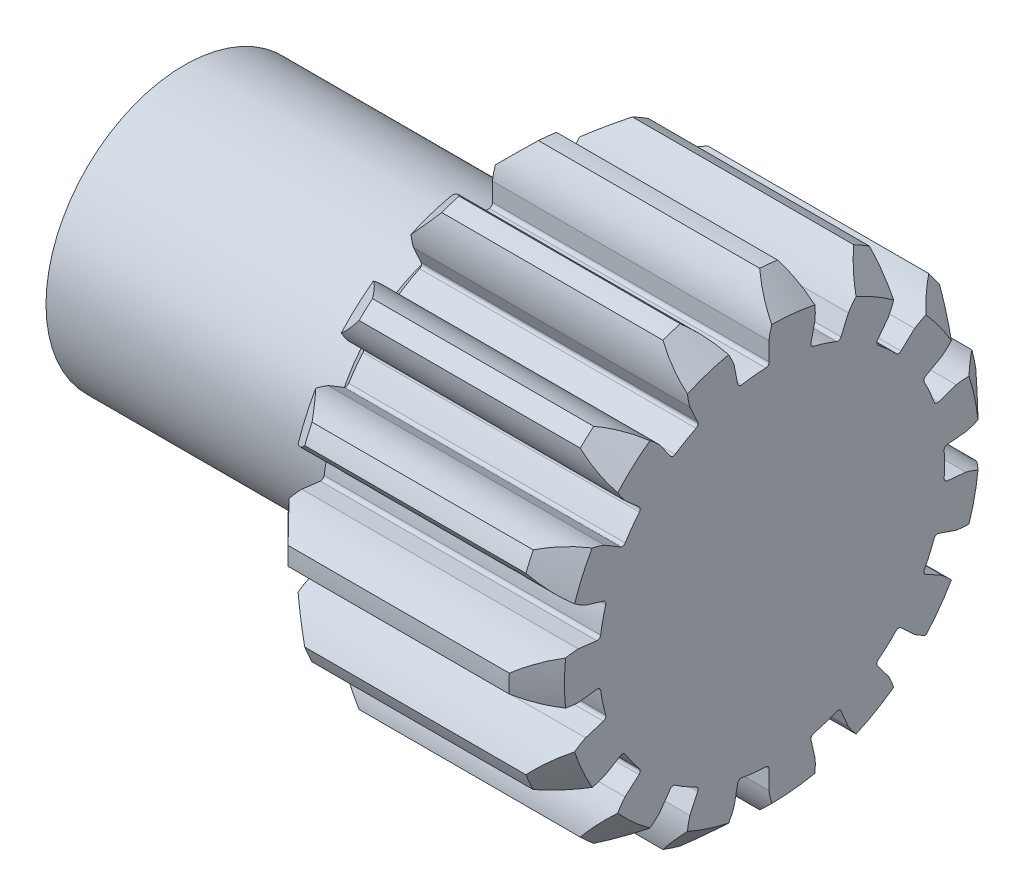
from build123d import *

# Parameters (mm, degrees)
SKETCH_2_R                       = 5
EXTRUDE_2_DEPTH                  = 8
SKETCH_5_R                       = 4
EXTRUDE_4_DEPTH                  = 9
HOLE_WIZARD_M31_D                = 2.5
HOLE_WIZARD_M31_DEPTH            = 8.5
HOLE_WIZARD_M31_CSINK_D          = 5
HOLE_WIZARD_M31_CSINK_ANGLE      = 90
HOLE_WIZARD_M31_TIP              = 0.751075774
EXTRUDE_5_REACH                  = 16.799
EXTRUDE_5_DIRECTION_2_REACH      = 16.799
FILLET_4_R                       = 0.1
PATTERN_CIRCULAR_1_COUNT         = 15
FILLET_4_OF_PATTERN_CIRCULAR_1_R = 0.1
FILLET_5_R                       = 0.2


with BuildPart() as part:
    # Эскиз2 → Бобышка-Вытянуть2 (new body)
    with BuildSketch(Plane(origin=(0, 0, 0), x_dir=(0, 0, -1), z_dir=(1, 0, 0))):
        Circle(SKETCH_2_R)
    extrude(amount=EXTRUDE_2_DEPTH)

    # Эскиз5 → Бобышка-Вытянуть4 (add)
    with BuildSketch(Plane.ZY):
        Circle(SKETCH_5_R)
    extrude(amount=EXTRUDE_4_DEPTH)

    # Отверстие обработанное метчиком M31
    with Locations(Plane.ZY.offset(9)):
        with Locations((0, 0)):
            CounterSinkHole(HOLE_WIZARD_M31_D / 2, HOLE_WIZARD_M31_CSINK_D / 2, depth=HOLE_WIZARD_M31_DEPTH, counter_sink_angle=HOLE_WIZARD_M31_CSINK_ANGLE)
            with Locations((0, 0, -(HOLE_WIZARD_M31_DEPTH + HOLE_WIZARD_M31_TIP / 2))):  # 118° drill point
                Cone(0, HOLE_WIZARD_M31_D / 2, HOLE_WIZARD_M31_TIP, mode=Mode.SUBTRACT)

    # Бобышка-Вытянуть5: up to this face of the body (flat: up to its plane)
    extrude_5_end = Plane(part.part.faces().sort_by_distance((8, 0, 0))[0])
    # Эскиз9 → Бобышка-Вытянуть5 (add, up to the picked face)
    with BuildSketch(Plane(origin=(4, 0, 0), x_dir=(0, 0, -1), z_dir=(1, 0, 0)), mode=Mode.PRIVATE) as extrude_5_sk1:
        with BuildLine():
            Line((-0.084030126, 5.637529504), (-0.07451916, 4.999444659))
            ThreePointArc((-0.07451916, 4.999444659), (0.522642316, 4.972609477), (1.11233373, 4.874701393))
            Line((1.11233373, 4.874701393), (1.254302158, 5.496865113))
            add(Edge.make_bspline(
                [(1.254302158, 5.496865113), (1.295961503, 6.143933553), (0.971317611, 6.730270581)],
                knots=[0, 0, 0, 1, 1, 1], degree=2))
            ThreePointArc((0.971317611, 6.730270581), (0.71079355, 6.762748889), (0.449209945, 6.785146308))
            add(Edge.make_bspline(
                [(-0.084030126, 5.637529504), (0.009753979, 6.279119411), (0.449209945, 6.785146308)],
                knots=[0, 0, 0, 1, 1, 1], degree=2))
        make_face()
    extrude_5_tool1 = split(extrude(extrude_5_sk1.sketch, amount=EXTRUDE_5_REACH, mode=Mode.PRIVATE), bisect_by=extrude_5_end, keep=Keep.BOTH, mode=Mode.PRIVATE)
    extrude_5 = extrude_5_tool1.solids().sort_by(Axis((4, 5.778954, -0.607393), (1, 0, 0)))[0]
    add(extrude_5)

    # Бобышка-Вытянуть5 direction 2: up to this face of the body (flat: up to its plane)
    extrude_5_direction_2_end = Plane(part.part.faces().sort_by_distance((0, 0, 4.858578644))[0])
    # Эскиз9 → Бобышка-Вытянуть5 direction 2 (add, up to the picked face)
    with BuildSketch(Plane(origin=(4, 0, 0), x_dir=(0, 0, -1), z_dir=(1, 0, 0)), mode=Mode.PRIVATE) as extrude_5_direction_2_sk1:
        with BuildLine():
            Line((-0.084030126, 5.637529504), (-0.07451916, 4.999444659))
            ThreePointArc((-0.07451916, 4.999444659), (0.522642316, 4.972609477), (1.11233373, 4.874701393))
            Line((1.11233373, 4.874701393), (1.254302158, 5.496865113))
            add(Edge.make_bspline(
                [(1.254302158, 5.496865113), (1.295961503, 6.143933553), (0.971317611, 6.730270581)],
                knots=[0, 0, 0, 1, 1, 1], degree=2))
            ThreePointArc((0.971317611, 6.730270581), (0.71079355, 6.762748889), (0.449209945, 6.785146308))
            add(Edge.make_bspline(
                [(-0.084030126, 5.637529504), (0.009753979, 6.279119411), (0.449209945, 6.785146308)],
                knots=[0, 0, 0, 1, 1, 1], degree=2))
        make_face()
    extrude_5_direction_2_tool1 = split(extrude(extrude_5_direction_2_sk1.sketch, amount=-EXTRUDE_5_DIRECTION_2_REACH, mode=Mode.PRIVATE), bisect_by=extrude_5_direction_2_end, keep=Keep.BOTH, mode=Mode.PRIVATE)
    extrude_5_direction_2 = extrude_5_direction_2_tool1.solids().sort_by(Axis((4, 5.778954, -0.607393), (-1, 0, 0)))[0]
    add(extrude_5_direction_2)

    # Скругление4
    fillet_4_edges = [part.edges().sort_by_distance(p)[0] for p in [
        (4, 4.999444659, 0.07451916),
        (4, 4.874701393, -1.11233373),
    ]]
    fillet(fillet_4_edges, radius=FILLET_4_R)

    # Круговой массив1: Бобышка-Вытянуть5, Бобышка-Вытянуть5 direction 2 ×15 about axis
    pattern_circular_1_axis = Axis((8, 0, 0), (-1, 0, 0))
    add([extrude_5.rotate(pattern_circular_1_axis, i * 360 / PATTERN_CIRCULAR_1_COUNT) for i in range(1, PATTERN_CIRCULAR_1_COUNT)])
    add([extrude_5_direction_2.rotate(pattern_circular_1_axis, i * 360 / PATTERN_CIRCULAR_1_COUNT) for i in range(1, PATTERN_CIRCULAR_1_COUNT)])

    # Скругление4 of Круговой массив1
    fillet_4_of_pattern_circular_1_edges = [part.edges().sort_by_distance(p)[0] for p in [
        (4, 4.597529632, -1.965380697),
        (4, 4.000834428, -2.998887107),
        (4, 3.400659964, -3.665448377),
        (4, 2.435186843, -4.366905659),
        (4, 1.615785295, -4.731726734),
        (4, 0.448473331, -4.979846551),
        (4, -0.448473331, -4.979846551),
        (4, -1.615785295, -4.731726734),
        (4, -2.435186843, -4.366905659),
        (4, -3.400659964, -3.665448377),
        (4, -4.000834428, -2.998887107),
        (4, -4.597529632, -1.965380697),
        (4, -4.874701393, -1.11233373),
        (4, -4.999444659, 0.07451916),
        (4, -4.905688202, 0.966552254),
        (4, -4.536910286, 2.101533978),
        (4, -4.088436955, 2.878312573),
        (4, -3.289902908, 3.765174479),
        (4, -2.564257815, 4.292386499),
        (4, -1.474041429, 4.777782107),
        (4, -0.596695204, 4.964267804),
        (4, 0.596695204, 4.964267804),
        (4, 1.474041429, 4.777782107),
        (4, 2.564257815, 4.292386499),
        (4, 3.289902908, 3.765174479),
        (4, 4.088436955, 2.878312573),
        (4, 4.536910286, 2.101533978),
        (4, 4.905688202, 0.966552254),
    ]]
    fillet(fillet_4_of_pattern_circular_1_edges, radius=FILLET_4_OF_PATTERN_CIRCULAR_1_R)

    # Эскиз10 → Вырез-Повернуть2 (revolve, cut)
    with BuildSketch(Plane.XY):
        Polygon((0, 6), (0, 6.8), (0.8, 6.8), align=None)
        Polygon((8, 6), (8, 6.8), (7.2, 6.8), align=None)
    revolve(axis=Axis((-9, 0, 0), (1, 0, 0)), mode=Mode.SUBTRACT)

    # Эскиз11 → Вырез-Повернуть3 (revolve, cut)
    with BuildSketch(Plane.XY):
        Polygon((0, 4), (0, 3.7), (-0.5, 3.7), (-0.8, 4), align=None)
    revolve(axis=Axis((-9, 0, 0), (1, 0, 0)), mode=Mode.SUBTRACT)

    # Скругление5
    fillet_5_edges = [part.edges().sort_by_distance(p)[0] for p in [
        (-0.5, -3.7, 0),
        (0, -3.7, 0),
    ]]
    fillet(fillet_5_edges, radius=FILLET_5_R)


solid = part.part
